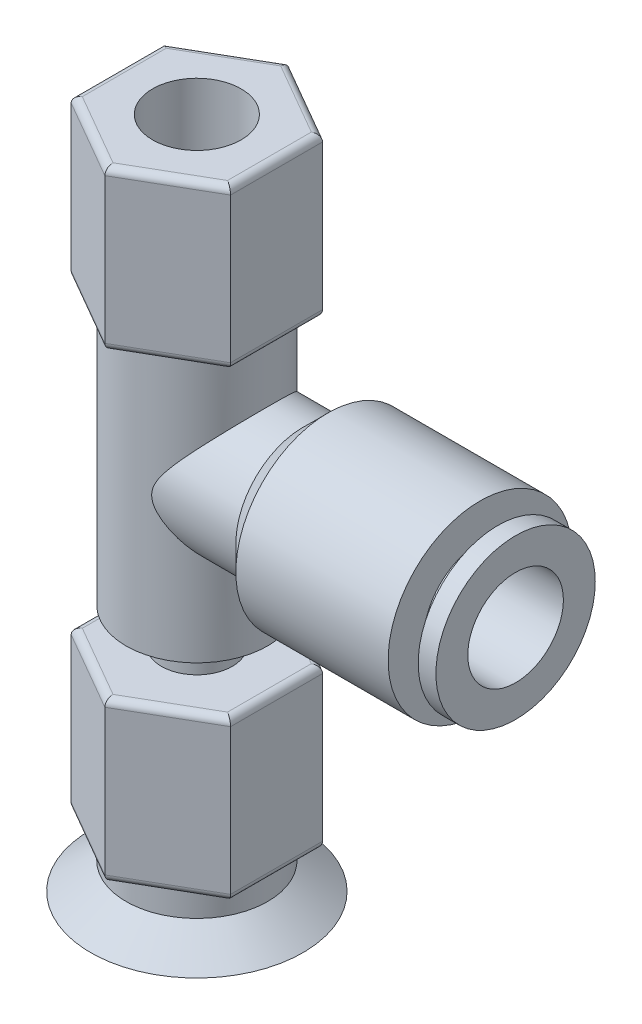
from build123d import *

# Parameters (mm, degrees)
BOSS_EXTRU_1_DEPTH      = 9
ESQUISSE3_R             = 2
BOSS_EXTRU_2_DEPTH      = 1
ESQUISSE4_R             = 2.5
BOSS_EXTRU_3_DEPTH      = 1
BOSS_EXTRU_4_START      = 15
ESQUISSE5_R             = 4
BOSS_EXTRU_4_DEPTH      = 15
BOSS_EXTRU_5_DEPTH      = 9
BOSS_EXTRU_6_DEPTH      = 2
BOSS_EXTRU_6_DEPTH_BACK = 4
ESQUISSE7_R             = 3.8
ESQUISSE8_R             = 5.2
BOSS_EXTRU_7_DEPTH      = 10
ESQUISSE9_R             = 3.2
BOSS_EXTRU_8_DEPTH      = 1
ESQUISSE10_R            = 4.5
BOSS_EXTRU_9_DEPTH      = 1
ESQUISSE11_R            = 2.7
ENL_V_MAT_EXTRU_1_DEPTH = 10
ENL_V_START             = -6
ESQUISSE12_R            = 2.5
ENL_V_MAT_EXTRU_2_DEPTH = 6
CONG_1_R                = 0.4
CHANFREIN1_SIZE         = 1.4


with BuildPart() as part:
    # Esquisse1 → Révolution1 (revolve)
    with BuildSketch(Plane.XY, mode=Mode.PRIVATE) as r_volution1_sk:
        Polygon((-5, 0), (-6, 0), (-4, 1.5), (-4, 3), (-2, 3), (-2, 1.5), align=None)
    revolve(r_volution1_sk.sketch.rotate(Axis((0, 0, 0), (0, 1, 0)), 270), axis=Axis((0, 0, 0), (0, 1, 0)))

    # Esquisse2 → Boss.-Extru.1 (add)
    with BuildSketch(Plane(origin=(0, 3, 0), x_dir=(1, 0, 0), z_dir=(0, 1, 0))):
        Polygon((0, -5.196152423), (4.5, -2.598076211), (4.5, 2.598076211), (0, 5.196152423), (-4.5, 2.598076211), (-4.5, -2.598076211), align=None)
    extrude(amount=BOSS_EXTRU_1_DEPTH)

    # Esquisse3 → Boss.-Extru.2 (add)
    with BuildSketch(Plane(origin=(0, 12, 0), x_dir=(1, 0, 0), z_dir=(0, 1, 0))):
        with Locations(Location((0, 0, 0), (0, 0, 90))):
            Circle(ESQUISSE3_R)
    extrude(amount=BOSS_EXTRU_2_DEPTH)

    # Esquisse4 → Boss.-Extru.3 (add)
    with BuildSketch(Plane(origin=(0, 13, 0), x_dir=(1, 0, 0), z_dir=(0, 1, 0))):
        with Locations(Location((0, 0, 0), (0, 0, 270))):
            Circle(ESQUISSE4_R)
    extrude(amount=BOSS_EXTRU_3_DEPTH)

    # Esquisse5 → Boss.-Extru.4 (add)
    with BuildSketch(Plane(origin=(0, 14, 0), x_dir=(1, 0, 0), z_dir=(0, 1, 0)).offset(BOSS_EXTRU_4_START)):
        with Locations(Location((0, 0, 0), (0, 0, 90))):
            Circle(ESQUISSE5_R)
    extrude(amount=-BOSS_EXTRU_4_DEPTH)

    # Esquisse6 → Boss.-Extru.5 (add)
    with BuildSketch(Plane(origin=(0, 29, 0), x_dir=(1, 0, 0), z_dir=(0, 1, 0))):
        Polygon((4.5, -2.598076211), (4.5, 2.598076211), (0, 5.196152423), (-4.5, 2.598076211), (-4.5, -2.598076211), (0, -5.196152423), align=None)
    extrude(amount=BOSS_EXTRU_5_DEPTH)

    # Esquisse7 → Boss.-Extru.6 (add, two sides: drawn at the far end of the back side and taken through both)
    with BuildSketch(Plane(origin=(4, 0, 0), x_dir=(0, 0, -1), z_dir=(1, 0, 0)).offset(-BOSS_EXTRU_6_DEPTH_BACK)):
        with Locations((0, 21.9)):
            Circle(ESQUISSE7_R)
    extrude(amount=BOSS_EXTRU_6_DEPTH + BOSS_EXTRU_6_DEPTH_BACK)

    # Esquisse8 → Boss.-Extru.7 (add)
    with BuildSketch(Plane(origin=(6, 0, 0), x_dir=(0, 0, -1), z_dir=(1, 0, 0))):
        with Locations((0, 21.9)):
            Circle(ESQUISSE8_R)
    extrude(amount=BOSS_EXTRU_7_DEPTH)

    # Esquisse9 → Boss.-Extru.8 (add)
    with BuildSketch(Plane(origin=(16, 0, 0), x_dir=(0, 0, -1), z_dir=(1, 0, 0))):
        with Locations((0, 21.9)):
            Circle(ESQUISSE9_R)
    extrude(amount=BOSS_EXTRU_8_DEPTH)

    # Esquisse10 → Boss.-Extru.9 (add)
    with BuildSketch(Plane(origin=(17, 0, 0), x_dir=(0, 0, -1), z_dir=(1, 0, 0))):
        with Locations((0, 21.89789892)):
            Circle(ESQUISSE10_R)
    extrude(amount=BOSS_EXTRU_9_DEPTH)

    # Esquisse11 → Enlèv. mat.-Extru.1 (cut)
    with BuildSketch(Plane(origin=(18, 0, 0), x_dir=(0, 0, -1), z_dir=(1, 0, 0))):
        with Locations((0, 21.9)):
            Circle(ESQUISSE11_R)
    extrude(amount=-ENL_V_MAT_EXTRU_1_DEPTH, mode=Mode.SUBTRACT)

    # Esquisse12 → Enlèv. mat.-Extru.2 (cut)
    with BuildSketch(Plane(origin=(0, 38, 0), x_dir=(1, 0, 0), z_dir=(0, 1, 0)).offset(ENL_V_START)):
        with Locations(Location((0, 0, 0), (0, 0, 270))):
            Circle(ESQUISSE12_R)
    extrude(amount=ENL_V_MAT_EXTRU_2_DEPTH, mode=Mode.SUBTRACT)

    # Congé1
    cong_1_edges = [part.edges().sort_by_distance(p)[0] for p in [
        (-2.25, 3, 3.897114317),
        (2.25, 3, 3.897114317),
        (4.5, 3, 0),
        (2.25, 3, -3.897114317),
        (-2.25, 3, -3.897114317),
        (-4.5, 3, 0),
        (-2.25, 12, 3.897114317),
        (2.25, 12, 3.897114317),
        (4.5, 12, 0),
        (2.25, 12, -3.897114317),
        (-2.25, 12, -3.897114317),
        (-4.5, 12, 0),
        (2.25, 29, 3.897114317),
        (4.5, 29, 0),
        (2.25, 29, -3.897114317),
        (-2.25, 29, -3.897114317),
        (-4.5, 29, 0),
        (-2.25, 29, 3.897114317),
        (2.25, 38, 3.897114317),
        (4.5, 38, 0),
        (2.25, 38, -3.897114317),
        (-2.25, 38, -3.897114317),
        (-4.5, 38, 0),
        (-2.25, 38, 3.897114317),
    ]]
    fillet(cong_1_edges, radius=CONG_1_R)

    # Chanfrein1
    chanfrein1_edges = [part.edges().sort_by_distance(p)[0] for p in [
        (6, 21.9, 5.2),
    ]]
    chamfer(chanfrein1_edges, length=CHANFREIN1_SIZE - 0.0001)  # a hair under: the kernel refuses the full size


solid = part.part
